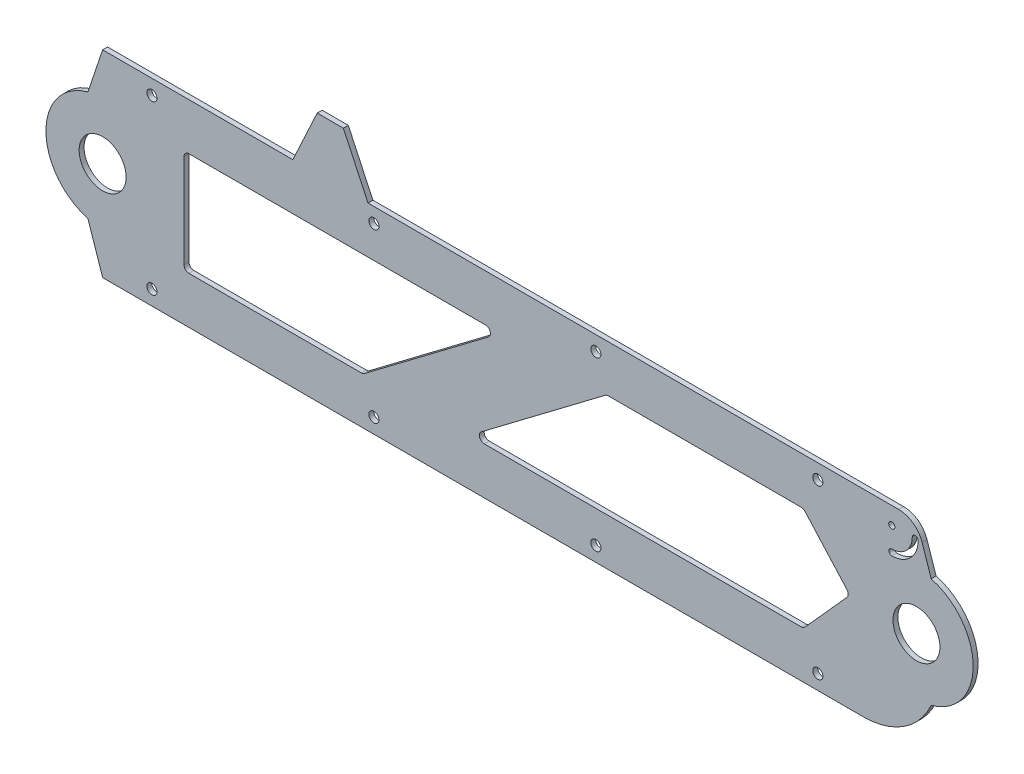
from build123d import *

# Parameters (mm, degrees)
SKETCH_1_R          = 9.52
SKETCH_1_R_2        = 1.25
EXTRUDE_1_DEPTH     = 2
SKETCH_2_R          = 2.05
CUT_EXTRUDE_1_DEPTH = 4
FILLET_1_R          = 2
FILLET_3_R          = 30
FILLET_6_R          = 10


with BuildPart() as part:
    # 草图1 → 凸台-拉伸1 (new body)
    with BuildSketch(Plane.XY):
        with BuildLine():
            Line((328.542857143, -40.145714286), (-1.457142857, -40.145714286))
            Line((-1.457142857, -40.145714286), (-7.409980895, -22.36200829))
            ThreePointArc((-7.409980895, -22.36200829), (-24.457142857, -0.145714286), (-7.409980895, 22.070579719))
            Line((-7.409980895, 22.070579719), (-1.457142857, 39.854285714))
            Line((-1.457142857, 39.854285714), (75.684411109, 39.854285714))
            Line((75.684411109, 39.854285714), (85.544413109, 61.154285714))
            Line((85.544413109, 61.154285714), (96.174870529, 61.154285714))
            Line((96.174870529, 61.154285714), (106.145912956, 39.854285714))
            Line((106.145912956, 39.854285714), (321.071621128, 39.854285714))
            Line((321.071621128, 39.854285714), (328.542857143, 39.854285714))
            Line((328.542857143, 39.854285714), (334.49569518, 22.070579719))
            ThreePointArc((334.49569518, 22.070579719), (351.542857143, -0.145714286), (334.49569518, -22.36200829))
            Line((334.49569518, -22.36200829), (328.542857143, -40.145714286))
        make_face()
        with Locations((-1.457142857, -0.145714286)):
            Circle(SKETCH_1_R, mode=Mode.SUBTRACT)
        with Locations((328.542857143, -0.145714286)):
            Circle(SKETCH_1_R, mode=Mode.SUBTRACT)
        with Locations((318.542857143, 32.854285714)):
            Circle(SKETCH_1_R_2, mode=Mode.SUBTRACT)
        with BuildLine():
            ThreePointArc((318.542857143, 22.154285714), (326.108899702, 25.288243156), (329.242857143, 32.854285714))
            ThreePointArc((329.242857143, 32.854285714), (328.042857143, 34.054285714), (326.842857143, 32.854285714))
            ThreePointArc((326.842857143, 32.854285714), (324.411843427, 26.98529943), (318.542857143, 24.554285714))
            ThreePointArc((318.542857143, 24.554285714), (317.342857143, 23.354285714), (318.542857143, 22.154285714))
        make_face(mode=Mode.SUBTRACT)
    extrude(amount=EXTRUDE_1_DEPTH)

    # 草图2 → 切除-拉伸1 (cut)
    with BuildSketch(Plane.XY.offset(2)):
        with Locations((108.542857143, 33.854285714)):
            Circle(SKETCH_2_R)
        with Locations((198.542857143, 33.854285714)):
            Circle(SKETCH_2_R)
        with Locations((288.542857143, 33.854285714)):
            Circle(SKETCH_2_R)
        with Locations((108.542857143, -34.145714286)):
            Circle(SKETCH_2_R)
        with Locations((198.542857143, -34.145714286)):
            Circle(SKETCH_2_R)
        with Locations((288.542857143, -34.145714286)):
            Circle(SKETCH_2_R)
        with Locations((18.542857143, -34.145714286)):
            Circle(SKETCH_2_R)
        with Locations((18.542857143, 33.854285714)):
            Circle(SKETCH_2_R)
        Polygon((31.542857143, -21.145714286), (104.183898028, -21.145714286), (159.772133322, 20.854285714), (31.542857143, 20.854285714), align=None)
        Polygon((147.313580964, -21.145714286), (202.901816258, 20.854285714), (282.737923896, 20.854285714), (301.563806249, -0.145714286), (282.737923896, -21.145714286), align=None)
    extrude(amount=-CUT_EXTRUDE_1_DEPTH, mode=Mode.SUBTRACT)

    # 圆角1
    fillet_1_edges = [part.edges().sort_by_distance(p)[0] for p in [
        (202.901816258, 20.854285714, 1),
        (282.737923896, 20.854285714, 1),
        (301.563806249, -0.145714286, 1),
        (31.542857143, -21.145714286, 1),
        (31.542857143, 20.854285714, 1),
        (159.772133322, 20.854285714, 1),
        (104.183898028, -21.145714286, 1),
        (282.737923896, -21.145714286, 1),
        (147.313580964, -21.145714286, 1),
    ]]
    fillet(fillet_1_edges, radius=FILLET_1_R)

    # 圆角3
    # the kernel refuses this fillet: 30 mm, written as the material it takes off along each edge
    with BuildSketch(Plane(origin=(328.542857143, -40.145714286, -53.618003483), x_dir=(0.3174242162824087, 0.9482836426499714, 0), z_dir=(0, 0, 1))) as fillet_3_piece_1:
        with BuildLine():
            CenterArc((21.640648186, 29.86075675), FILLET_3_R, 198.507223716, 65.970321092)
            Line((-6.807861094, 20.338030262), (-7.376831279, 20.147575732))
            Line((-7.376831279, 20.147575732), (-0.568970186, -0.19045453))
            Line((-0.568970186, -0.19045453), (0, -0.6))
            ThreePointArc((0, -0.6), (9.376786225, -0.6), (18.695830935, -0.597215135))
            Line((18.695830935, -0.597215135), (18.75357245, 0))
        make_face()
    extrude(amount=109.236006966, mode=Mode.SUBTRACT)

    # 圆角6
    fillet_6_edges = [part.edges().sort_by_distance(p)[0] for p in [
        (328.542857143, 39.854285714, 1),
    ]]
    fillet(fillet_6_edges, radius=FILLET_6_R)


solid = part.part
